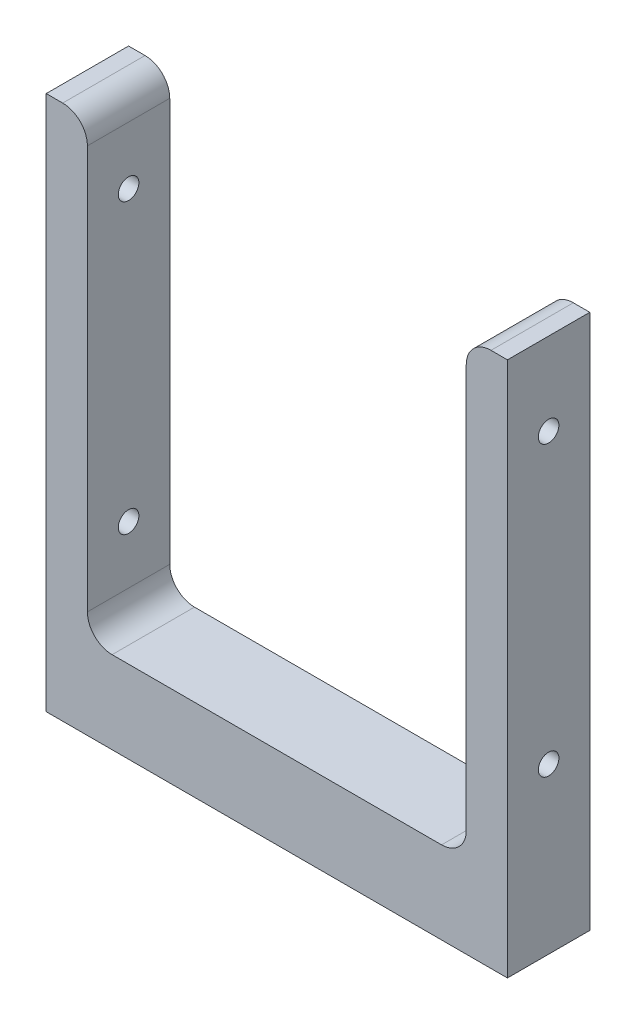
from build123d import *

# Parameters (mm, degrees)
EXTRUDE_1_DEPTH = 10
FILLET_1_R      = 3
M3X0_52_D       = 2.5


with BuildPart() as part:
    # Эскиз1 → Бобышка-Вытянуть1 (new body)
    with BuildSketch(Plane.XY):
        Polygon((28, 32.5), (23, 32.5), (23, -22.5), (-23, -22.5), (-23, 32.5), (-28, 32.5), (-28, -32.5), (28, -32.5), align=None)
    extrude(amount=EXTRUDE_1_DEPTH)

    # Скругление1
    fillet_1_edges = [part.edges().sort_by_distance(p)[0] for p in [
        (23, -22.5, 5),
        (-23, -22.5, 5),
        (-23, 32.5, 5),
        (23, 32.5, 5),
    ]]
    fillet(fillet_1_edges, radius=FILLET_1_R)

    # Отверстие обработанное метчиком M3x0.52 (through all)
    with Locations(Plane(origin=(28, 0, 0), x_dir=(0, 0, -1), z_dir=(1, 0, 0))):
        with Locations((-5, 22.5), (-5, -12.5)):
            Hole(M3X0_52_D / 2)


solid = part.part
